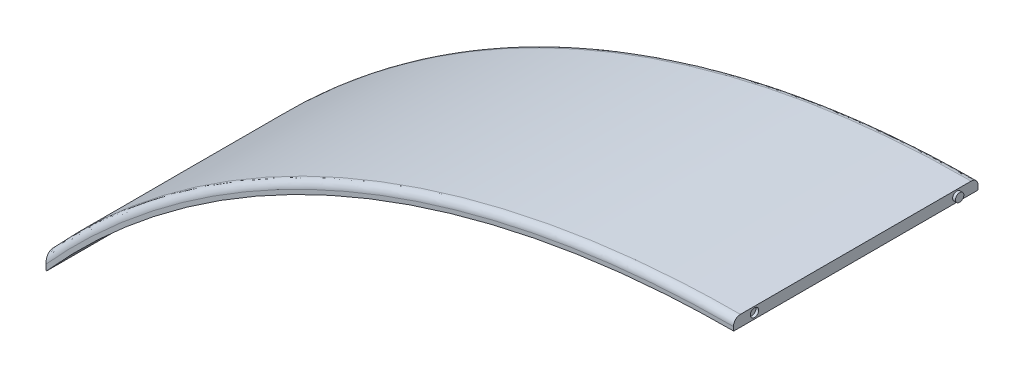
from build123d import *

# Parameters (mm, degrees)
BOSS_EXTRUDE1_DEPTH            = 22.225
CUT_EXTRUDE1_REACH             = 331.298
SKETCH2_R                      = 4.7625
CUT_EXTRUDE1_DIRECTION_2_REACH = 331.298
CUT_EXTRUDE2_DEPTH             = 254
FILLET1_R                      = 12.7
FILLET4_R                      = 1.2446
F_1_4_CLEARANCE_HOLE1_D        = 6.5278
F_1_4_CLEARANCE_HOLE1_DEPTH    = 6.35
F_1_4_CLEARANCE_HOLE1_TIP      = 1.961148974
SKETCH8_W                      = 63.920753762
SKETCH8_H                      = 259.326964074
CUT_EXTRUDE6_DEPTH             = 480.06
SKETCH11_W                     = 69.041661627
SKETCH11_H                     = 278.286213366
CUT_EXTRUDE9_DEPTH             = 480.06
SKETCH12_W                     = 69.259180794
SKETCH12_H                     = 339.749461213
CUT_EXTRUDE10_DEPTH            = 480.06
SKETCH13_R                     = 0.762
BOSS_EXTRUDE2_DEPTH            = 0.508
SKETCH14_R                     = 0.762
CUT_EXTRUDE11_DEPTH            = 0.508
SKETCH15_R                     = 0.762
CUT_EXTRUDE12_DEPTH            = 0.508
SKETCH16_R                     = 0.762
BOSS_EXTRUDE3_DEPTH            = 0.508


with BuildPart() as part:
    # Sketch1 → Boss-Extrude1 (new, symmetric)
    with BuildSketch(Plane.XY):
        with BuildLine():
            add(Edge.make_bspline(
                [(247.65, 12.7), (247.65, 151.138652105), (159.851901214, 215.9), (69.85, 215.9)],
                knots=[0, 0, 0, 0, 1, 1, 1, 1], degree=3))
            Line((69.85, 215.9), (-69.85, 215.9))
            add(Edge.make_bspline(
                [(-69.85, 215.9), (-159.851901214, 215.9), (-247.65, 151.138652105), (-247.65, 12.7)],
                knots=[0, 0, 0, 0, 1, 1, 1, 1], degree=3))
            Line((-247.65, 12.7), (-247.65, -12.7))
            Line((-247.65, -12.7), (-245.618, -12.7))
            Line((-245.618, -12.7), (-245.618, 12.7))
            add(Edge.make_bspline(
                [(-69.85, 213.868), (-75.40386678, 213.868), (-86.529134162, 213.367524052), (-108.503296863, 210.348405687), (-135.224023579, 202.760511588), (-165.078062417, 187.457160851), (-187.304904565, 169.454437631), (-203.008125467, 151.842675097), (-213.624406237, 137.012147223), (-222.956422719, 120.542434531), (-230.879834274, 102.41559311), (-237.26896978, 82.613605898), (-241.209008074, 64.702111997), (-243.466672055, 49.517673174), (-244.696729955, 37.702743517), (-245.322441099, 27.489835839), (-245.575395866, 19.120958406), (-245.618, 14.831688899), (-245.618, 12.7)],
                knots=[0, 0, 0, 0, 0.0625, 0.125, 0.25, 0.375, 0.5, 0.5625, 0.625, 0.6875, 0.75, 0.8125, 0.875, 0.90625, 0.9375, 0.96875, 0.984375, 1, 1, 1, 1], degree=3))
            Line((-69.85, 213.868), (69.85, 213.868))
            add(Edge.make_bspline(
                [(245.618, 12.7), (245.618, 14.831688899), (245.575395866, 19.120958406), (245.322441099, 27.489835839), (244.696729955, 37.702743517), (243.466672055, 49.517673174), (241.209008074, 64.702111997), (237.26896978, 82.613605898), (230.879834274, 102.41559311), (222.956422719, 120.542434531), (213.624406237, 137.012147223), (203.008125467, 151.842675097), (187.304904565, 169.454437631), (165.078062417, 187.457160851), (135.224023579, 202.760511588), (108.503296863, 210.348405687), (86.529134162, 213.367524052), (75.40386678, 213.868), (69.85, 213.868)],
                knots=[0, 0, 0, 0, 0.015625, 0.03125, 0.0625, 0.09375, 0.125, 0.1875, 0.25, 0.3125, 0.375, 0.4375, 0.5, 0.625, 0.75, 0.875, 0.9375, 1, 1, 1, 1], degree=3))
            Line((245.618, 12.7), (245.618, -12.7))
            Line((245.618, -12.7), (247.65, -12.7))
            Line((247.65, -12.7), (247.65, 12.7))
        make_face()
    extrude(amount=BOSS_EXTRUDE1_DEPTH, both=True)

    # Sketch2 → Cut-Extrude1 (cut, up to next)
    with BuildSketch(Plane(origin=(0, 0, 0), x_dir=(0, 0, -1), z_dir=(1, 0, 0)), mode=Mode.PRIVATE) as cut_extrude1_sk1:
        Circle(SKETCH2_R)
    cut_extrude1_tool1 = extrude(cut_extrude1_sk1.sketch, amount=-CUT_EXTRUDE1_REACH, mode=Mode.PRIVATE) & part.part
    add(cut_extrude1_tool1.solids().sort_by_distance((0, 0, 0))[0], mode=Mode.SUBTRACT)

    # Sketch2 → Cut-Extrude1 direction 2 (cut, up to next)
    with BuildSketch(Plane(origin=(0, 0, 0), x_dir=(0, 0, -1), z_dir=(1, 0, 0)), mode=Mode.PRIVATE) as cut_extrude1_direction_2_sk1:
        Circle(SKETCH2_R)
    cut_extrude1_direction_2_tool1 = extrude(cut_extrude1_direction_2_sk1.sketch, amount=CUT_EXTRUDE1_DIRECTION_2_REACH, mode=Mode.PRIVATE) & part.part
    add(cut_extrude1_direction_2_tool1.solids().sort_by_distance((0, 0, 0))[0], mode=Mode.SUBTRACT)

    # Sketch3 → Cut-Extrude2 (cut, symmetric)
    with BuildSketch(Plane(origin=(0, 0, 0), x_dir=(0, 0, -1), z_dir=(1, 0, 0))):
        Polygon((-22.225, 215.9), (-12.7, -12.7), (-47.625, -12.7), (-47.625, 215.9), align=None)
        Polygon((22.225, 215.9), (12.7, -12.7), (47.625, -12.7), (47.625, 215.9), align=None)
    extrude(amount=CUT_EXTRUDE2_DEPTH, both=True, mode=Mode.SUBTRACT)

    # Fillet1
    fillet1_edges = [part.edges().sort_by_distance(p)[0] for p in [
        (-246.634, -12.7, -12.7),
        (-246.634, -12.7, 12.7),
        (246.634, -12.7, -12.7),
        (246.634, -12.7, 12.7),
    ]]
    fillet(fillet1_edges, radius=FILLET1_R)

    # Fillet4
    fillet4_edges = [part.edges().sort_by_distance(p)[0] for p in [
        (247.65, -9.165276607, -9.309489742),
        (247.65, 6.085646041, -13.482735252),
        (-247.65, -9.165276607, -9.309489742),
        (-247.65, 6.085646041, -13.482735252),
        (247.65, -9.165276607, 9.309489742),
        (247.65, 6.085646041, 13.482735252),
        (-247.65, -9.165276607, 9.309489742),
        (-247.65, 6.085646041, 13.482735252),
        (0, 215.9, 22.225),
        (-203.084938623, 154.469294773, 19.665387282),
        (-247.65, -12.7, 0),
        (-203.084938623, 154.469294773, -19.665387282),
        (0, 215.9, -22.225),
        (203.084938625, 154.469294774, -19.665387282),
        (247.65, -12.7, 0),
        (203.084938625, 154.469294774, 19.665387282),
    ]]
    fillet(fillet4_edges, radius=FILLET4_R)

    # 1/4 Clearance Hole1
    with Locations(Plane(origin=(5.734151724, 215.9, -6.658847299), x_dir=(1, 0, 0), z_dir=(0, 1, 0))):
        with Locations((35.540848276, -16.183847299), (35.540848276, 2.866152701), (-47.009151724, -16.183847299), (-47.009151724, 2.866152701)):
            Hole(F_1_4_CLEARANCE_HOLE1_D / 2, depth=F_1_4_CLEARANCE_HOLE1_DEPTH)
            with Locations((0, 0, -(F_1_4_CLEARANCE_HOLE1_DEPTH + F_1_4_CLEARANCE_HOLE1_TIP / 2))):  # 118° drill point
                Cone(0, F_1_4_CLEARANCE_HOLE1_D / 2, F_1_4_CLEARANCE_HOLE1_TIP, mode=Mode.SUBTRACT)

    # Sketch8 → Cut-Extrude6 (cut)
    with BuildSketch(Plane.ZY.offset(-196.85)):
        with Locations((0.135769602, 94.203521296)):
            Rectangle(SKETCH8_W, SKETCH8_H)
    extrude(amount=-CUT_EXTRUDE6_DEPTH, mode=Mode.SUBTRACT)

    # Sketch11 → Cut-Extrude9 (cut)
    with BuildSketch(Plane.ZY.offset(196.85)):
        with Locations((3.644033196, 86.264048918)):
            Rectangle(SKETCH11_W, SKETCH11_H)
    extrude(amount=CUT_EXTRUDE9_DEPTH, mode=Mode.SUBTRACT)

    # Sketch12 → Cut-Extrude10 (cut)
    with BuildSketch(Plane.ZY.offset(69.85)):
        with Locations((5.5117615, 54.432923768)):
            Rectangle(SKETCH12_W, SKETCH12_H)
    extrude(amount=-CUT_EXTRUDE10_DEPTH, mode=Mode.SUBTRACT)

    # Sketch13 → Boss-Extrude2 (add)
    with BuildSketch(Plane(origin=(-69.85, 0, 0), x_dir=(0, 0, -1), z_dir=(1, 0, 0))):
        with Locations((18.330333333, 214.884)):
            Circle(SKETCH13_R)
    extrude(amount=BOSS_EXTRUDE2_DEPTH)

    # Sketch14 → Cut-Extrude11 (cut)
    with BuildSketch(Plane(origin=(-69.85, 0, 0), x_dir=(0, 0, -1), z_dir=(1, 0, 0))):
        with Locations((-18.369360809, 214.884)):
            Circle(SKETCH14_R)
    extrude(amount=-CUT_EXTRUDE11_DEPTH, mode=Mode.SUBTRACT)

    # Sketch15 → Cut-Extrude12 (cut)
    with BuildSketch(Plane.ZY.offset(196.85)):
        with Locations((-16.028769638, 160.132431528)):
            Circle(SKETCH15_R)
    extrude(amount=-CUT_EXTRUDE12_DEPTH, mode=Mode.SUBTRACT)

    # Sketch16 → Boss-Extrude3 (add)
    with BuildSketch(Plane.ZY.offset(196.85)):
        with Locations((16.028769638, 160.132431528)):
            Circle(SKETCH16_R)
    extrude(amount=BOSS_EXTRUDE3_DEPTH)


solid = part.part
